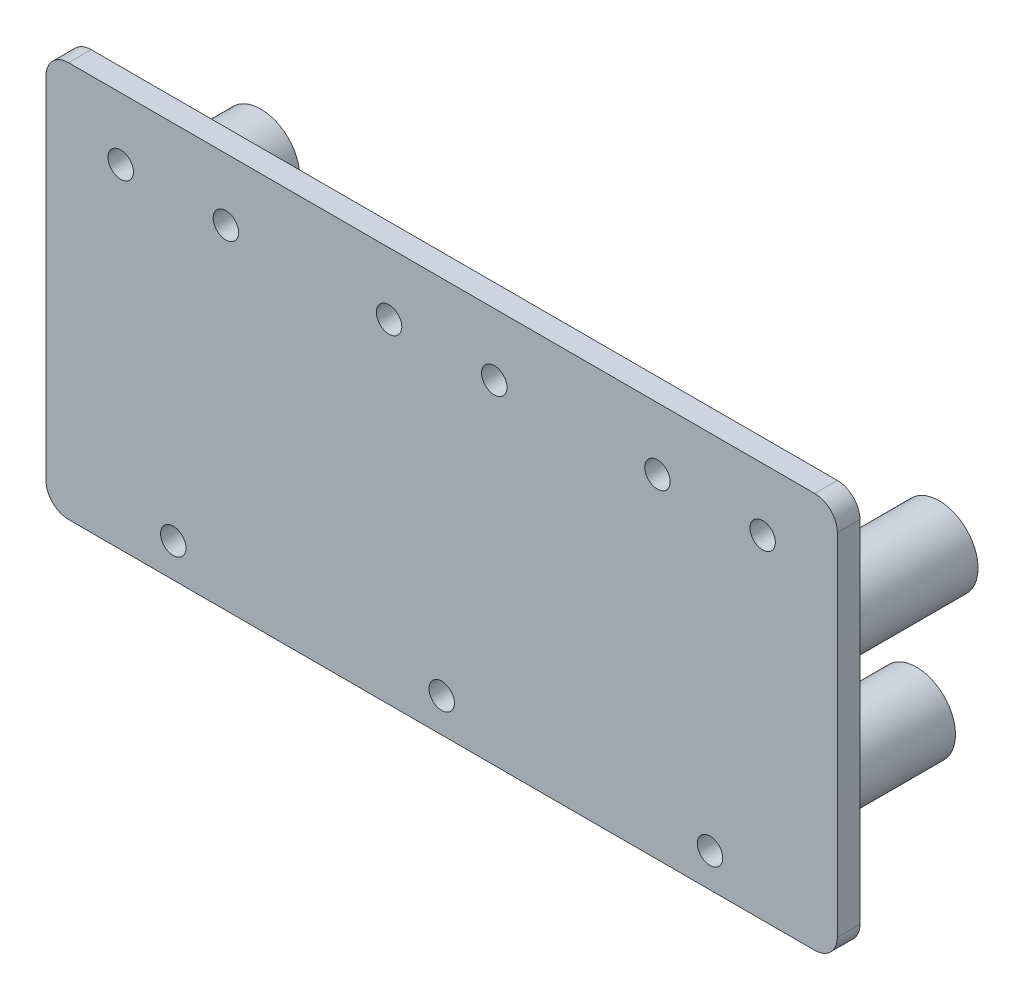
from build123d import *

# Parameters (mm, degrees)
BOSS_EXTRUDE1_DEPTH     = 2
SKETCH2_R               = 3.45
SKETCH2_R_2             = 1.95
BOSS_EXTRUDE2_DEPTH     = 12
CUT_EXTRUDE1_DEPTH      = 42.560197305
CUT_EXTRUDE1_DEPTH_BACK = 42.560197305
SKETCH3_R               = 1.125000036


with BuildPart() as part:
    # Sketch1 → Boss-Extrude1 (new body)
    with BuildSketch(Plane.XY):
        with BuildLine():
            Line((-33, -17.5), (33, -17.5))
            ThreePointArc((33, -17.5), (34.414213562, -16.914213562), (35, -15.5))
            Line((35, -15.5), (35, 15.5))
            ThreePointArc((35, 15.5), (34.414213562, 16.914213562), (33, 17.5))
            Line((33, 17.5), (-33, 17.5))
            ThreePointArc((-33, 17.5), (-34.414213562, 16.914213562), (-35, 15.5))
            Line((-35, 15.5), (-35, -15.5))
            ThreePointArc((-35, -15.5), (-34.414213562, -16.914213562), (-33, -17.5))
        make_face()
    extrude(amount=BOSS_EXTRUDE1_DEPTH)

    # Sketch2 → Boss-Extrude2 (add)
    # profile 1 of 4: a face of its own
    with BuildSketch(Plane(origin=(0, 0, 0), x_dir=(-1, 0, 0), z_dir=(0, 0, -1))):
        with Locations((28, -8.75)):
            Circle(SKETCH2_R)
        with Locations((28, -8.75)):
            Circle(SKETCH2_R_2, mode=Mode.SUBTRACT)
    # profile 2 of 4: a face of its own
    with BuildSketch(Plane(origin=(0, 0, 0), x_dir=(-1, 0, 0), z_dir=(0, 0, -1))):
        with Locations((30, 5)):
            Circle(SKETCH2_R)
        with Locations((30, 5)):
            Circle(SKETCH2_R_2, mode=Mode.SUBTRACT)
    # profile 3 of 4: a face of its own
    with BuildSketch(Plane(origin=(0, 0, 0), x_dir=(-1, 0, 0), z_dir=(0, 0, -1))):
        with Locations((-30, 5)):
            Circle(SKETCH2_R)
        with Locations((-30, 5)):
            Circle(SKETCH2_R_2, mode=Mode.SUBTRACT)
    # profile 4 of 4: a face of its own
    with BuildSketch(Plane(origin=(0, 0, 0), x_dir=(-1, 0, 0), z_dir=(0, 0, -1))):
        with Locations((-28, -8.75)):
            Circle(SKETCH2_R)
        with Locations((-28, -8.75)):
            Circle(SKETCH2_R_2, mode=Mode.SUBTRACT)
    extrude(amount=BOSS_EXTRUDE2_DEPTH)

    # Sketch3 → Cut-Extrude1 (cut, two sides: drawn at the far end of the back side and taken through both)
    with BuildSketch(Plane.XY.offset(2).offset(-CUT_EXTRUDE1_DEPTH_BACK)):
        with Locations((-23.74, -14.5)):
            Circle(SKETCH3_R)
        with Locations((0, -14.5)):
            Circle(SKETCH3_R)
        with Locations((23.74, -14.5)):
            Circle(SKETCH3_R)
        with Locations((-19.086651241, 11.999301868)):
            Circle(SKETCH3_R)
        with Locations((-28.393348759, 11.999301868)):
            Circle(SKETCH3_R)
        with Locations((-4.653348759, 11.999301868)):
            Circle(SKETCH3_R)
        with Locations((4.653348759, 11.999301868)):
            Circle(SKETCH3_R)
        with Locations((19.086651241, 11.999301868)):
            Circle(SKETCH3_R)
        with Locations((28.393348759, 11.999301868)):
            Circle(SKETCH3_R)
    extrude(amount=CUT_EXTRUDE1_DEPTH + CUT_EXTRUDE1_DEPTH_BACK, mode=Mode.SUBTRACT)


solid = part.part
